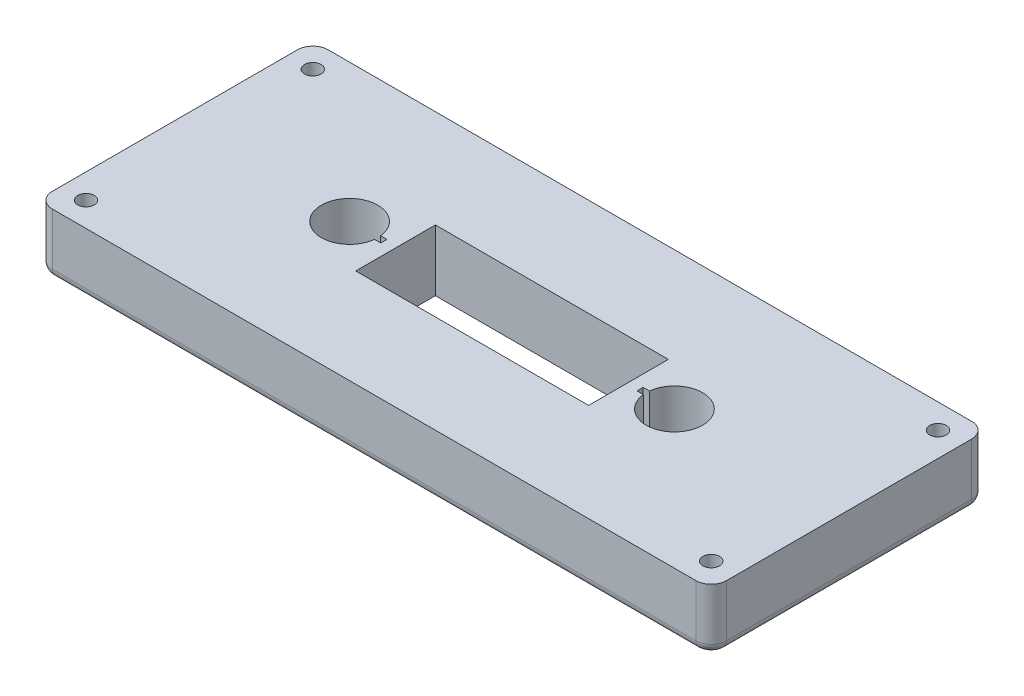
from build123d import *

# Parameters (mm, degrees)
BOSS_EXTRUDE1_DEPTH = 10
SKETCH2_R           = 1.35
CUT_EXTRUDE2_DEPTH  = 61.259853966
FILLET4_R           = 1.5
SKETCH4_W           = 38
SKETCH4_H           = 13
CUT_EXTRUDE3_DEPTH  = 61.259854057


with BuildPart() as part:
    # Sketch1 → Boss-Extrude1 (new body)
    with BuildSketch(Plane(origin=(0, 0, 0), x_dir=(1, 0, 0), z_dir=(0, 1, 0))):
        with BuildLine():
            Line((-52.5, -22.5), (52.5, -22.5))
            ThreePointArc((52.5, -22.5), (54.267766953, -21.767766953), (55, -20))
            Line((55, -20), (55, 20))
            ThreePointArc((55, 20), (54.267766953, 21.767766953), (52.5, 22.5))
            Line((52.5, 22.5), (-52.5, 22.5))
            ThreePointArc((-52.5, 22.5), (-54.267766953, 21.767766953), (-55, 20))
            Line((-55, 20), (-55, -20))
            ThreePointArc((-55, -20), (-54.267766953, -21.767766953), (-52.5, -22.5))
        make_face()
    extrude(amount=BOSS_EXTRUDE1_DEPTH)

    # Sketch2 → Cut-Extrude2 (cut, through all)
    with BuildSketch(Plane(origin=(0, 10, 0), x_dir=(1, 0, 0), z_dir=(0, 1, 0))):
        with Locations((-51, 18.5)):
            Circle(SKETCH2_R)
        with Locations((-51, -18.5)):
            Circle(SKETCH2_R)
        with Locations((51, -18.5)):
            Circle(SKETCH2_R)
        with Locations((51, 18.5)):
            Circle(SKETCH2_R)
    extrude(amount=-CUT_EXTRUDE2_DEPTH, mode=Mode.SUBTRACT)

    # Fillet4
    fillet4_edges = [part.edges().sort_by_distance(p)[0] for p in [
        (55, 0, 0),
        (0, 0, -22.5),
        (0, 0, 22.5),
        (-55, 0, 0),
        (-54.267766953, 0, -21.767766953),
        (54.267766953, 0, -21.767766953),
        (54.267766953, 0, 21.767766953),
        (-54.267766953, 0, 21.767766953),
    ]]
    fillet(fillet4_edges, radius=FILLET4_R)

    # Sketch4 → Cut-Extrude3 (cut, through all)
    with BuildSketch(Plane(origin=(0, 0, 0), x_dir=(-1, 0, 0), z_dir=(0, -1, 0))):
        Rectangle(SKETCH4_W, SKETCH4_H)
        with BuildLine():
            Line((20.903728907, -0.502566941), (20.903728907, 0.502566941))
            Line((20.903728907, 0.502566941), (21.927536061, 0.502566941))
            ThreePointArc((21.927536061, 0.502566941), (31.1, 0), (21.927536061, -0.502566941))
            Line((21.927536061, -0.502566941), (20.903728907, -0.502566941))
        make_face()
        with BuildLine():
            Line((-20.903728907, -0.502566941), (-21.927536061, -0.502566941))
            ThreePointArc((-21.927536061, -0.502566941), (-31.1, 0), (-21.927536061, 0.502566941))
            Line((-21.927536061, 0.502566941), (-20.903728907, 0.502566941))
            Line((-20.903728907, 0.502566941), (-20.903728907, -0.502566941))
        make_face()
    extrude(amount=-CUT_EXTRUDE3_DEPTH, mode=Mode.SUBTRACT)


solid = part.part
